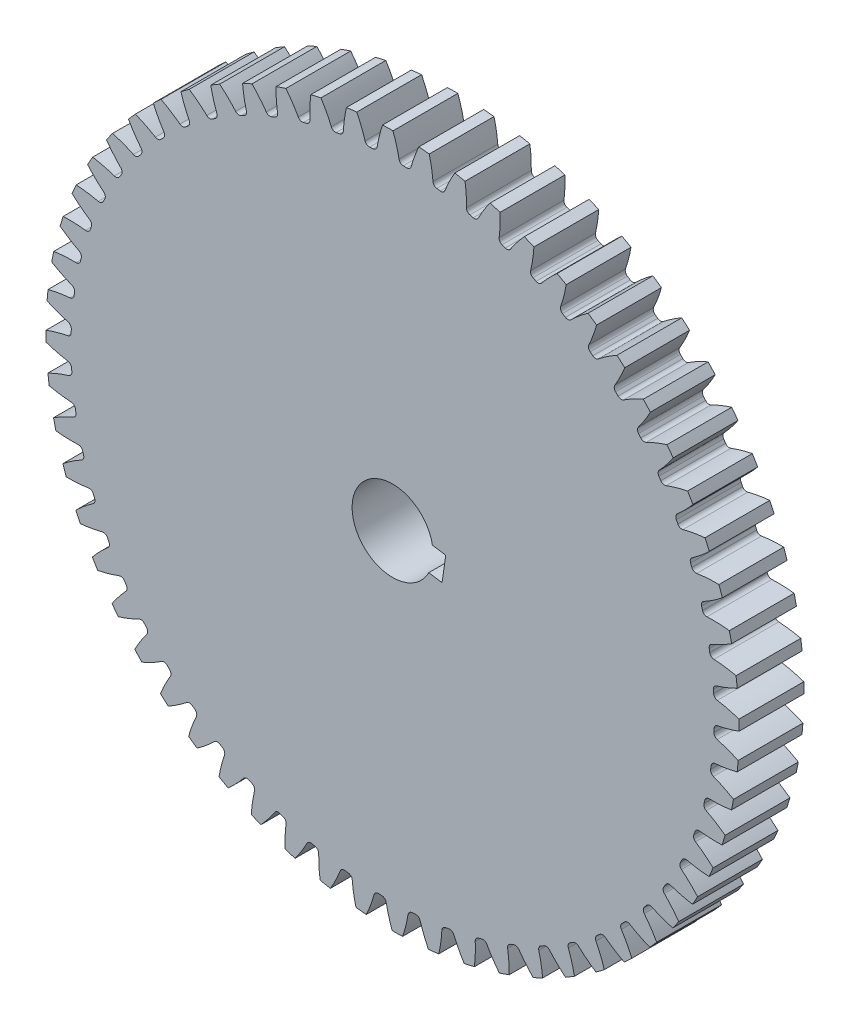
from build123d import *

# Parameters (mm, degrees)
SKETCH3_R          = 53.473684211
GEARBODY_DEPTH     = 10
TOOTHCUT_DEPTH     = 77.281516805
CIRPATTERN1_COUNT  = 60
HUB1DIA_R          = 12.5
HUB1_DEPTH         = 10
BOREDIA_R          = 6.25
BORE_DEPTH         = 12700
KWY1_DEPTH         = 6350
SS1HUB1_D          = 3
SS1HUB1_DEPTH      = 12.5
SS1HUB1_TIP        = 0.901290929
SS3HUB1_D          = 3
SS3HUB1_DEPTH      = 12.5
SS3HUB1_TIP        = 0.901290929
SKETCH6_W          = 6
SKETCH6_H          = 10
CUT_EXTRUDE1_DEPTH = 2.5


with BuildPart() as part:
    # Sketch3 → gearBody (new body)
    with BuildSketch(Plane.XY):
        Circle(SKETCH3_R)
    extrude(amount=GEARBODY_DEPTH)

    # Sketch2 → toothCut (cut, through all)
    with BuildSketch(Plane.XY):
        with BuildLine():
            ThreePointArc((49.580208619, -2.176941178), (49.591221225, -1.909695527), (49.600793343, -1.642394404))
            ThreePointArc((49.600793343, -1.642394404), (49.76450098, -1.2204873), (50.155745746, -0.993037683))
            ThreePointArc((50.155745746, -0.993037683), (57.554753381, 2.007110905), (63.250118724, 7.60255719))
            ThreePointArc((63.250118724, 7.60255719), (63.658204855, -2.451397365), (62.478143548, -12.444194361))
            ThreePointArc((62.478143548, -12.444194361), (57.229953846, -6.427325542), (50.083579789, -2.867052608))
            ThreePointArc((50.083579789, -2.867052608), (49.710985336, -2.610188504), (49.580208619, -2.176941178))
        make_face()
    toothcut = extrude(amount=TOOTHCUT_DEPTH, mode=Mode.SUBTRACT)

    # CirPattern1: toothCut ×60 about axis
    cirpattern1_axis = Axis((0, 0, 10), (0, 0, -1))
    for i in range(1, CIRPATTERN1_COUNT):
        add(toothcut.rotate(cirpattern1_axis, i * 360 / CIRPATTERN1_COUNT), mode=Mode.SUBTRACT)

    # hub1Dia → hub1 (add)
    with BuildSketch(Plane(origin=(0, 0, 0), x_dir=(-1, 0, 0), z_dir=(0, 0, -1))):
        Circle(HUB1DIA_R)
    extrude(amount=HUB1_DEPTH)

    # boreDia → bore (cut, symmetric)
    with BuildSketch(Plane.XY):
        Circle(BOREDIA_R)
    extrude(amount=BORE_DEPTH, both=True, mode=Mode.SUBTRACT)

    # kwy1sketch → kwy1 (cut, symmetric)
    with BuildSketch(Plane.XY):
        Polygon((8.203545226, 0.837762333), (7.632663356, -3.121289812), (2.683848174, -2.407687475), (0, 0), (3.254730044, 1.55136467), align=None)
    extrude(amount=KWY1_DEPTH, both=True, mode=Mode.SUBTRACT)

    # ss1Hub1
    with Locations(Plane(origin=(12.372037955, -1.784005843, -5), x_dir=(0.14272046747, 0.98976303637, 0), z_dir=(0.98976303637, -0.14272046747, 0))):
        with Locations((0, 0)):
            Hole(SS1HUB1_D / 2, depth=SS1HUB1_DEPTH)
            with Locations((0, 0, -(SS1HUB1_DEPTH + SS1HUB1_TIP / 2))):  # 118° drill point
                Cone(0, SS1HUB1_D / 2, SS1HUB1_TIP, mode=Mode.SUBTRACT)

    # ss3Hub1
    with Locations(Plane(origin=(1.784005843, 12.372037955, -5), x_dir=(0.98976303637, -0.14272046747, 0), z_dir=(0.14272046747, 0.98976303637, 0))):
        with Locations((0, 0)):
            Hole(SS3HUB1_D / 2, depth=SS3HUB1_DEPTH)
            with Locations((0, 0, -(SS3HUB1_DEPTH + SS3HUB1_TIP / 2))):  # 118° drill point
                Cone(0, SS3HUB1_D / 2, SS3HUB1_TIP, mode=Mode.SUBTRACT)

    # Sketch6 → Cut-Extrude1 (cut)
    with BuildSketch(Plane(origin=(1.113219646, 7.720151684, 0), x_dir=(0.9897630363704416, -0.1427204674696805, 0), z_dir=(-0.1427204674696805, -0.9897630363704416, 0))):
        with Locations((0, -5)):
            Rectangle(SKETCH6_W, SKETCH6_H)
    extrude(amount=-CUT_EXTRUDE1_DEPTH, mode=Mode.SUBTRACT)


solid = part.part
